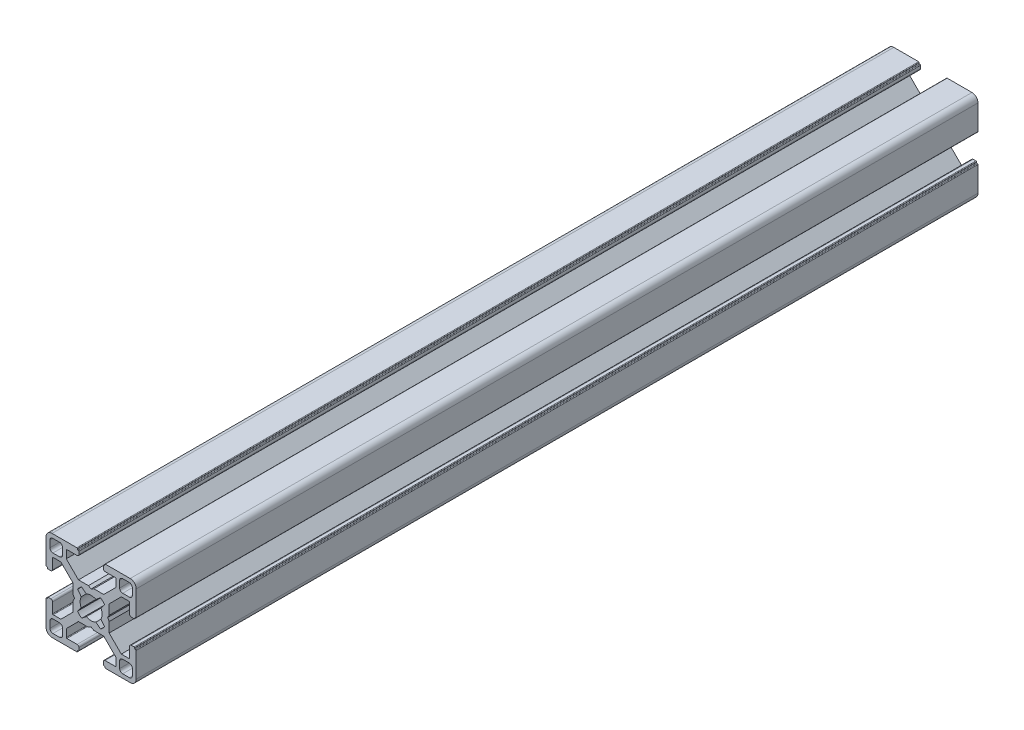
from build123d import *

# Parameters (mm, degrees)
DODANIE_WYCI_GNI_CIE1_DEPTH = 280


with BuildPart() as part:
    # Szkic1 → Dodanie-wyciągnięcie1 (new body)
    with BuildSketch(Plane.XY):
        with BuildLine():
            Line((96.56, 29.575148163), (97.459999946, 29.06))
            Line((97.459999946, 29.06), (100.764466193, 29.06))
            Line((100.764466193, 29.06), (104.810000327, 25.010000763))
            Line((104.810000327, 25.010000763), (104.810000327, 22.460001166))
            ThreePointArc((104.810000327, 22.460001166), (104.751421565, 22.318579525), (104.609999924, 22.260000763))
            Line((104.609999924, 22.260000763), (101.210000197, 22.260000763))
            ThreePointArc((101.210000197, 22.260000763), (100.785735989, 22.084264774), (100.61, 21.660000566))
            Line((100.61, 21.660000566), (100.61, 20.760000374))
            ThreePointArc((100.61, 20.760000374), (100.668578753, 20.618578753), (100.810000374, 20.56))
            Line((100.810000374, 20.56), (100.910000144, 20.56))
            ThreePointArc((100.910000144, 20.56), (101.05142109, 20.501421526), (101.109999564, 20.36000058))
            Line((101.109999564, 20.36000058), (101.109999564, 20.260000381))
            ThreePointArc((101.109999564, 20.260000381), (101.16857832, 20.118578755), (101.309999945, 20.06))
            Line((101.309999945, 20.06), (109.560000346, 20.06))
            ThreePointArc((109.560000346, 20.06), (110.974213664, 20.645786336), (111.56, 22.059999654))
            Line((111.56, 22.059999654), (111.56, 30.310000479))
            ThreePointArc((111.56, 30.310000479), (111.501421273, 30.451422036), (111.359999716, 30.510000763))
            Line((111.359999716, 30.510000763), (111.260000611, 30.510000763))
            ThreePointArc((111.260000611, 30.510000763), (111.118579054, 30.56857949), (111.060000327, 30.710001047))
            Line((111.060000327, 30.710001047), (111.060000327, 30.810000479))
            ThreePointArc((111.060000327, 30.810000479), (111.0014216, 30.951422036), (110.860000043, 31.010000763))
            Line((110.860000043, 31.010000763), (109.95999994, 31.010000763))
            ThreePointArc((109.95999994, 31.010000763), (109.535735606, 30.834264722), (109.359999564, 30.410000387))
            Line((109.359999564, 30.410000387), (109.359999564, 27.010000284))
            ThreePointArc((109.359999564, 27.010000284), (109.301420837, 26.868578727), (109.15999928, 26.81))
            Line((109.15999928, 26.81), (106.609999564, 26.81))
            Line((106.609999564, 26.81), (102.56446543, 30.855534134))
            Line((102.56446543, 30.855534134), (102.56446543, 34.160000381))
            Line((102.56446543, 34.160000381), (102.044852164, 35.06))
            Line((102.044852164, 35.06), (102.56446543, 35.959999619))
            Line((102.56446543, 35.959999619), (102.56446543, 39.264465866))
            Line((102.56446543, 39.264465866), (106.609999564, 43.31))
            Line((106.609999564, 43.31), (109.15999928, 43.31))
            ThreePointArc((109.15999928, 43.31), (109.301420837, 43.251421273), (109.359999564, 43.109999716))
            Line((109.359999564, 43.109999716), (109.359999564, 39.709999613))
            ThreePointArc((109.359999564, 39.709999613), (109.535735606, 39.285735278), (109.95999994, 39.109999237))
            Line((109.95999994, 39.109999237), (110.860000043, 39.109999237))
            ThreePointArc((110.860000043, 39.109999237), (111.0014216, 39.168577964), (111.060000327, 39.309999521))
            Line((111.060000327, 39.309999521), (111.060000327, 39.409998953))
            ThreePointArc((111.060000327, 39.409998953), (111.118579054, 39.55142051), (111.260000611, 39.609999237))
            Line((111.260000611, 39.609999237), (111.359999716, 39.609999237))
            ThreePointArc((111.359999716, 39.609999237), (111.501421273, 39.668577964), (111.56, 39.809999521))
            Line((111.56, 39.809999521), (111.56, 48.060000346))
            ThreePointArc((111.56, 48.060000346), (110.974213664, 49.474213664), (109.560000346, 50.06))
            Line((109.560000346, 50.06), (101.309999945, 50.06))
            ThreePointArc((101.309999945, 50.06), (101.16857832, 50.001421245), (101.109999564, 49.859999619))
            Line((101.109999564, 49.859999619), (101.109999564, 49.75999942))
            ThreePointArc((101.109999564, 49.75999942), (101.05142109, 49.618578474), (100.910000144, 49.56))
            Line((100.910000144, 49.56), (100.810000374, 49.56))
            ThreePointArc((100.810000374, 49.56), (100.668578753, 49.501421247), (100.61, 49.359999626))
            Line((100.61, 49.359999626), (100.61, 48.459999434))
            ThreePointArc((100.61, 48.459999434), (100.785735989, 48.035735226), (101.210000197, 47.859999237))
            Line((101.210000197, 47.859999237), (104.609999924, 47.859999237))
            ThreePointArc((104.609999924, 47.859999237), (104.751421565, 47.801420475), (104.810000327, 47.659998834))
            Line((104.810000327, 47.659998834), (104.810000327, 45.109999237))
            Line((104.810000327, 45.109999237), (100.764466193, 41.06))
            Line((100.764466193, 41.06), (97.459999946, 41.06))
            Line((97.459999946, 41.06), (96.56, 40.544851837))
            Line((96.56, 40.544851837), (95.660000054, 41.06))
            Line((95.660000054, 41.06), (92.355533807, 41.06))
            Line((92.355533807, 41.06), (88.309999673, 45.109999237))
            Line((88.309999673, 45.109999237), (88.309999673, 47.659998834))
            ThreePointArc((88.309999673, 47.659998834), (88.368578435, 47.801420475), (88.510000076, 47.859999237))
            Line((88.510000076, 47.859999237), (91.909999803, 47.859999237))
            ThreePointArc((91.909999803, 47.859999237), (92.334264011, 48.035735226), (92.51, 48.459999434))
            Line((92.51, 48.459999434), (92.51, 49.359999626))
            ThreePointArc((92.51, 49.359999626), (92.451421247, 49.501421247), (92.309999626, 49.56))
            Line((92.309999626, 49.56), (92.209999856, 49.56))
            ThreePointArc((92.209999856, 49.56), (92.06857891, 49.618578474), (92.010000436, 49.75999942))
            Line((92.010000436, 49.75999942), (92.010000436, 49.859999619))
            ThreePointArc((92.010000436, 49.859999619), (91.95142168, 50.001421245), (91.810000055, 50.06))
            Line((91.810000055, 50.06), (83.559999654, 50.06))
            ThreePointArc((83.559999654, 50.06), (82.145786336, 49.474213664), (81.56, 48.060000346))
            Line((81.56, 48.060000346), (81.56, 39.809999521))
            ThreePointArc((81.56, 39.809999521), (81.618578727, 39.668577964), (81.760000284, 39.609999237))
            Line((81.760000284, 39.609999237), (81.859999389, 39.609999237))
            ThreePointArc((81.859999389, 39.609999237), (82.001420946, 39.55142051), (82.059999673, 39.409998953))
            Line((82.059999673, 39.409998953), (82.059999673, 39.309999521))
            ThreePointArc((82.059999673, 39.309999521), (82.1185784, 39.168577964), (82.259999957, 39.109999237))
            Line((82.259999957, 39.109999237), (83.16000006, 39.109999237))
            ThreePointArc((83.16000006, 39.109999237), (83.584264394, 39.285735278), (83.760000436, 39.709999613))
            Line((83.760000436, 39.709999613), (83.760000436, 43.109999716))
            ThreePointArc((83.760000436, 43.109999716), (83.818579163, 43.251421273), (83.96000072, 43.31))
            Line((83.96000072, 43.31), (86.510000436, 43.31))
            Line((86.510000436, 43.31), (90.55553457, 39.264465866))
            Line((90.55553457, 39.264465866), (90.55553457, 35.959999619))
            Line((90.55553457, 35.959999619), (91.075147836, 35.06))
            Line((91.075147836, 35.06), (90.55553457, 34.160000381))
            Line((90.55553457, 34.160000381), (90.55553457, 30.855534134))
            Line((90.55553457, 30.855534134), (86.510000436, 26.81))
            Line((86.510000436, 26.81), (83.96000072, 26.81))
            ThreePointArc((83.96000072, 26.81), (83.818579163, 26.868578727), (83.760000436, 27.010000284))
            Line((83.760000436, 27.010000284), (83.760000436, 30.410000387))
            ThreePointArc((83.760000436, 30.410000387), (83.584264394, 30.834264722), (83.16000006, 31.010000763))
            Line((83.16000006, 31.010000763), (82.259999957, 31.010000763))
            ThreePointArc((82.259999957, 31.010000763), (82.1185784, 30.951422036), (82.059999673, 30.810000479))
            Line((82.059999673, 30.810000479), (82.059999673, 30.710001047))
            ThreePointArc((82.059999673, 30.710001047), (82.001420946, 30.56857949), (81.859999389, 30.510000763))
            Line((81.859999389, 30.510000763), (81.760000284, 30.510000763))
            ThreePointArc((81.760000284, 30.510000763), (81.618578727, 30.451422036), (81.56, 30.310000479))
            Line((81.56, 30.310000479), (81.56, 22.059999654))
            ThreePointArc((81.56, 22.059999654), (82.145786336, 20.645786336), (83.559999654, 20.06))
            Line((83.559999654, 20.06), (91.810000055, 20.06))
            ThreePointArc((91.810000055, 20.06), (91.95142168, 20.118578755), (92.010000436, 20.260000381))
            Line((92.010000436, 20.260000381), (92.010000436, 20.36000058))
            ThreePointArc((92.010000436, 20.36000058), (92.06857891, 20.501421526), (92.209999856, 20.56))
            Line((92.209999856, 20.56), (92.309999626, 20.56))
            ThreePointArc((92.309999626, 20.56), (92.451421247, 20.618578753), (92.51, 20.760000374))
            Line((92.51, 20.760000374), (92.51, 21.660000566))
            ThreePointArc((92.51, 21.660000566), (92.334264011, 22.084264774), (91.909999803, 22.260000763))
            Line((91.909999803, 22.260000763), (88.510000076, 22.260000763))
            ThreePointArc((88.510000076, 22.260000763), (88.368578435, 22.318579525), (88.309999673, 22.460001166))
            Line((88.309999673, 22.460001166), (88.309999673, 25.010000763))
            Line((88.309999673, 25.010000763), (92.355533807, 29.06))
            Line((92.355533807, 29.06), (95.660000054, 29.06))
            Line((95.660000054, 29.06), (96.56, 29.575148163))
        make_face()
        with BuildLine():
            Line((109.26000109, 48.760000398), (107.060000327, 48.760000398))
            ThreePointArc((107.060000327, 48.760000398), (106.352893543, 48.467107182), (106.060000327, 47.760000398))
            Line((106.060000327, 47.760000398), (106.060000327, 45.559999635))
            ThreePointArc((106.060000327, 45.559999635), (106.352893543, 44.852892851), (107.060000327, 44.559999635))
            Line((107.060000327, 44.559999635), (109.26000109, 44.559999635))
            ThreePointArc((109.26000109, 44.559999635), (109.967107874, 44.852892851), (110.26000109, 45.559999635))
            Line((110.26000109, 45.559999635), (110.26000109, 47.760000398))
            ThreePointArc((110.26000109, 47.760000398), (109.967107874, 48.467107182), (109.26000109, 48.760000398))
        make_face(mode=Mode.SUBTRACT)
        with BuildLine():
            Line((94.959870476, 38.340561767), (93.424070588, 39.578400903))
            ThreePointArc((93.424070588, 39.578400903), (92.678997741, 38.957155561), (92.054663108, 38.214669473))
            Line((92.054663108, 38.214669473), (93.279438268, 36.660129597))
            ThreePointArc((93.279438268, 36.660129597), (92.91, 35.06), (93.279438268, 33.459870403))
            Line((93.279438268, 33.459870403), (92.054663108, 31.905330527))
            ThreePointArc((92.054663108, 31.905330527), (92.678997741, 31.162844439), (93.424070588, 30.541599097))
            Line((93.424070588, 30.541599097), (94.959870476, 31.779438233))
            ThreePointArc((94.959870476, 31.779438233), (96.56, 31.41), (98.160129524, 31.779438233))
            Line((98.160129524, 31.779438233), (99.695929412, 30.541599097))
            ThreePointArc((99.695929412, 30.541599097), (100.441002259, 31.162844439), (101.065336892, 31.905330527))
            Line((101.065336892, 31.905330527), (99.840561732, 33.459870403))
            ThreePointArc((99.840561732, 33.459870403), (100.21, 35.06), (99.840561732, 36.660129597))
            Line((99.840561732, 36.660129597), (101.065336892, 38.214669473))
            ThreePointArc((101.065336892, 38.214669473), (100.441002259, 38.957155561), (99.695929412, 39.578400903))
            Line((99.695929412, 39.578400903), (98.160129524, 38.340561767))
            ThreePointArc((98.160129524, 38.340561767), (96.56, 38.71), (94.959870476, 38.340561767))
        make_face(mode=Mode.SUBTRACT)
        with BuildLine():
            Line((83.85999891, 21.359999602), (86.059999673, 21.359999602))
            ThreePointArc((86.059999673, 21.359999602), (86.767106457, 21.652892818), (87.059999673, 22.359999602))
            Line((87.059999673, 22.359999602), (87.059999673, 24.560000365))
            ThreePointArc((87.059999673, 24.560000365), (86.767106457, 25.267107149), (86.059999673, 25.560000365))
            Line((86.059999673, 25.560000365), (83.85999891, 25.560000365))
            ThreePointArc((83.85999891, 25.560000365), (83.152892126, 25.267107149), (82.85999891, 24.560000365))
            Line((82.85999891, 24.560000365), (82.85999891, 22.359999602))
            ThreePointArc((82.85999891, 22.359999602), (83.152892126, 21.652892818), (83.85999891, 21.359999602))
        make_face(mode=Mode.SUBTRACT)
        with BuildLine():
            Line((110.26000109, 22.359999602), (110.26000109, 24.560000365))
            ThreePointArc((110.26000109, 24.560000365), (109.967107874, 25.267107149), (109.26000109, 25.560000365))
            Line((109.26000109, 25.560000365), (107.060000327, 25.560000365))
            ThreePointArc((107.060000327, 25.560000365), (106.352893543, 25.267107149), (106.060000327, 24.560000365))
            Line((106.060000327, 24.560000365), (106.060000327, 22.359999602))
            ThreePointArc((106.060000327, 22.359999602), (106.352893543, 21.652892818), (107.060000327, 21.359999602))
            Line((107.060000327, 21.359999602), (109.26000109, 21.359999602))
            ThreePointArc((109.26000109, 21.359999602), (109.967107874, 21.652892818), (110.26000109, 22.359999602))
        make_face(mode=Mode.SUBTRACT)
        with BuildLine():
            Line((86.059999673, 48.760000398), (83.85999891, 48.760000398))
            ThreePointArc((83.85999891, 48.760000398), (83.152892126, 48.467107182), (82.85999891, 47.760000398))
            Line((82.85999891, 47.760000398), (82.85999891, 45.559999635))
            ThreePointArc((82.85999891, 45.559999635), (83.152892126, 44.852892851), (83.85999891, 44.559999635))
            Line((83.85999891, 44.559999635), (86.059999673, 44.559999635))
            ThreePointArc((86.059999673, 44.559999635), (86.767106457, 44.852892851), (87.059999673, 45.559999635))
            Line((87.059999673, 45.559999635), (87.059999673, 47.760000398))
            ThreePointArc((87.059999673, 47.760000398), (86.767106457, 48.467107182), (86.059999673, 48.760000398))
        make_face(mode=Mode.SUBTRACT)
    extrude(amount=DODANIE_WYCI_GNI_CIE1_DEPTH)


solid = part.part
